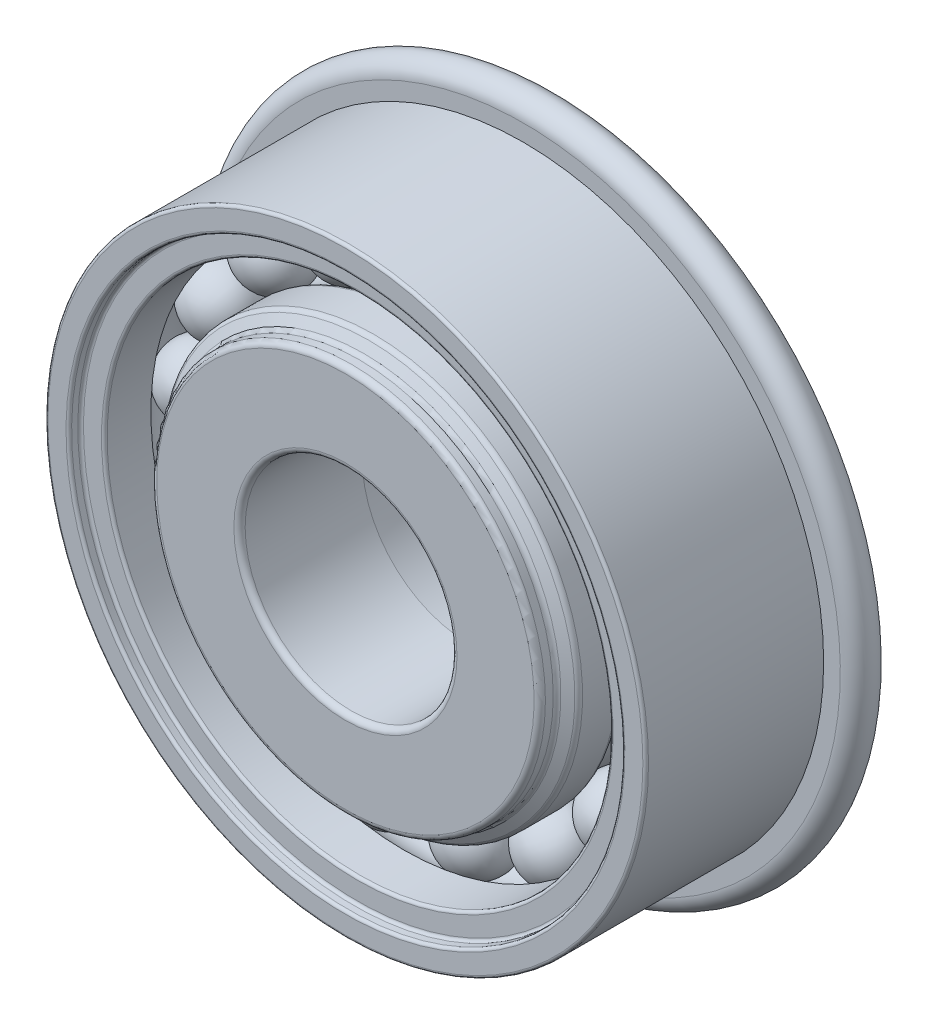
from build123d import *

# Parameters (mm, degrees)
FILLET4_R          = 0.762
CIRPATTERN3_COUNT  = 17
FILLET2_R          = 0.127
FILLET3_R          = 0.127
FILLET5_R          = 0.254
SKETCH12_R         = 12.811125
SKETCH12_R_2       = 11.37285
CUT_EXTRUDE1_DEPTH = 1.143


with BuildPart() as part:
    # Sketch2 → Revolve1 (revolve)
    with BuildSketch(Plane(origin=(0, 0, 0), x_dir=(0, 0, -1), z_dir=(1, 0, 0)), mode=Mode.PRIVATE) as revolve1_sk:
        with BuildLine():
            Line((2.4384, 13.5001), (-5.5626, 13.5001))
            Line((-5.5626, 13.5001), (-5.5626, 12.436475))
            Line((-5.5626, 12.436475), (-5.0307875, 12.436475))
            Line((-5.0307875, 12.436475), (-5.0307875, 11.37285))
            Line((-5.0307875, 11.37285), (-2.936915329, 11.37285))
            ThreePointArc((-2.936915329, 11.37285), (-1.5621, 12.1666), (-0.187284671, 11.37285))
            Line((-0.187284671, 11.37285), (3.9624, 11.37285))
            Line((3.9624, 11.37285), (3.9624, 14.2494))
            ThreePointArc((3.9624, 14.2494), (3.2004, 15.0114), (2.4384, 14.2494))
            Line((2.4384, 14.2494), (2.4384, 13.5001))
        make_face()
    revolve(revolve1_sk.sketch.rotate(Axis((0, 0, 5.5626), (0, 0, -1)), 180), axis=Axis((0, 0, 5.5626), (0, 0, -1)))

    # Fillet2
    fillet2_edges = [part.edges().sort_by_distance(p)[0] for p in [
        (0, 11.37285, 5.0307875),
        (0, 12.436475, 5.0307875),
    ]]
    fillet(fillet2_edges, radius=FILLET2_R)

    # Fillet3
    fillet3_edges = [part.edges().sort_by_distance(p)[0] for p in [
        (0, 12.436475, 5.5626),
        (0, 13.5001, 5.5626),
    ]]
    fillet(fillet3_edges, radius=FILLET3_R)

    # Sketch12 → Cut-Extrude1 (cut)
    with BuildSketch(Plane(origin=(0, 0, -3.9624), x_dir=(-1, 0, 0), z_dir=(0, 0, -1))):
        with Locations(Location((0, 0, 0), (0, 0, 90))):
            Circle(SKETCH12_R)
        with Locations(Location((0, 0, 0), (0, 0, 270))):
            Circle(SKETCH12_R_2, mode=Mode.SUBTRACT)
    extrude(amount=-CUT_EXTRUDE1_DEPTH, mode=Mode.SUBTRACT)


with BuildPart() as body_2:
    # Sketch3 → Revolve2 (revolve)
    with BuildSketch(Plane(origin=(0, 0, 0), x_dir=(0, 0, -1), z_dir=(1, 0, 0)), mode=Mode.PRIVATE) as revolve2_sk:
        with BuildLine():
            Line((-5.5626, 8.7376), (-4.811034287, 8.7376))
            Line((-4.811034287, 8.7376), (-4.435251431, 9.388475))
            Line((-4.435251431, 9.388475), (-2.612132552, 9.388475))
            ThreePointArc((-2.612132552, 9.388475), (-1.5621, 8.9916), (-0.512067448, 9.388475))
            Line((-0.512067448, 9.388475), (2.062617144, 9.388475))
            Line((2.062617144, 9.388475), (2.4384, 8.7376))
            Line((2.4384, 8.7376), (5.5626, 8.7376))
            Line((5.5626, 8.7376), (5.5626, 4.7625))
            Line((5.5626, 4.7625), (-5.5626, 4.7625))
            Line((-5.5626, 4.7625), (-5.5626, 8.7376))
        make_face()
    revolve(revolve2_sk.sketch.rotate(Axis((0, 0, 5.5626), (0, 0, -1)), 180), axis=Axis((0, 0, 5.5626), (0, 0, -1)))

    # Sketch5 → Cut-Revolve2 (revolve, cut)
    with BuildSketch(Plane(origin=(0, 0, 0), x_dir=(0, 0, -1), z_dir=(1, 0, 0)), mode=Mode.PRIVATE) as cut_revolve2_sk:
        with BuildLine():
            Line((5.5626, 5.756275), (5.5626, 4.7625))
            Line((5.5626, 4.7625), (-0.043602413, 4.7625))
            Line((-0.043602413, 4.7625), (4.892977196, 5.194394752))
            ThreePointArc((4.892977196, 5.194394752), (5.316368679, 5.369769247), (5.5626, 5.756275))
        make_face()
    revolve(cut_revolve2_sk.sketch.rotate(Axis((0, 0, 5.5626), (0, 0, -1)), 180), axis=Axis((0, 0, 5.5626), (0, 0, -1)), mode=Mode.SUBTRACT)

    # Sketch6 → Cut-Revolve3 (revolve, cut)
    with BuildSketch(Plane(origin=(0, 0, 0), x_dir=(0, 0, -1), z_dir=(1, 0, 0)), mode=Mode.PRIVATE) as cut_revolve3_sk:
        with BuildLine():
            Line((5.31725484, 5.822015037), (5.5626, 5.756275))
            Line((5.5626, 5.756275), (5.5626, 5.854885056))
            Line((5.5626, 5.854885056), (5.19458226, 5.854885056))
            ThreePointArc((5.19458226, 5.854885056), (5.0714666, 5.66163218), (4.859770858, 5.573944932))
            Line((4.859770858, 5.573944932), (3.9624, 5.495435155))
            Line((3.9624, 5.495435155), (3.9624, 5.367950036))
            Line((3.9624, 5.367950036), (4.870839638, 5.447428206))
            ThreePointArc((4.870839638, 5.447428206), (5.153100626, 5.564344535), (5.31725484, 5.822015037))
        make_face()
    revolve(cut_revolve3_sk.sketch.rotate(Axis((0, 0, 5.5626), (0, 0, -1)), 180), axis=Axis((0, 0, 5.5626), (0, 0, -1)), mode=Mode.SUBTRACT)

    # Fillet4
    # the kernel refuses this fillet: 0.762 mm, written as the material it takes off along each edge
    with BuildSketch(Plane(origin=(0, 0, -5.5626), x_dir=(0, -1, 0), z_dir=(1, 0, 0))) as fillet4_piece_1:
        with BuildLine():
            CenterArc((6.507128859, -0.762), FILLET4_R, 90, 58.866285833)
            Line((5.854885056, -0.36801774), (5.84184018, -0.360138095))
            ThreePointArc((5.84184018, -0.360138095), (5.839645056, -0.18400887), (5.839645056, 0))
            Line((5.839645056, 0), (5.854885056, 0.01524))
            Line((5.854885056, 0.01524), (6.507128859, 0.01524))
            Line((6.507128859, 0.01524), (6.507128859, 0))
        make_face()
    revolve(axis=Axis((0, 0, -5.5626), (0, 0, -1)), mode=Mode.SUBTRACT)

    # Sketch7 → Cut-Revolve4 (revolve, cut)
    with BuildSketch(Plane(origin=(0, 0, 0), x_dir=(0, 0, -1), z_dir=(1, 0, 0)), mode=Mode.PRIVATE) as cut_revolve4_sk:
        Polygon((5.5626, 7.743825), (5.5626, 8.7376), (5.231341667, 8.7376), (5.231341667, 8.406341667), (5.231341667, 8.075083333), (5.231341667, 7.743825), align=None)
    revolve(cut_revolve4_sk.sketch.rotate(Axis((0, 0, 5.5626), (0, 0, -1)), 180), axis=Axis((0, 0, 5.5626), (0, 0, -1)), mode=Mode.SUBTRACT)

    # Fillet5
    fillet5_edges = [body_2.edges().sort_by_distance(p)[0] for p in [
        (0, 4.7625, 5.5626),
        (0, 7.743825, -5.5626),
        (0, 8.7376, -5.231341667),
        (0, 8.7376, 5.5626),
        (0, 8.7376, 4.811034287),
        (0, 9.388475, 4.435251431),
        (0, 9.388475, 2.612132552),
        (0, 9.388475, 0.512067448),
        (0, 8.7376, -2.4384),
    ]]
    fillet(fillet5_edges, radius=FILLET5_R)


with BuildPart() as body_3:
    # Sketch11 → Revolve3 (revolve)
    with BuildSketch(Plane(origin=(0, 0, 0), x_dir=(0, 0, -1), z_dir=(1, 0, 0))):
        with BuildLine():
            Line((-1.5621, 12.1666), (-1.5621, 8.9916))
            ThreePointArc((-1.5621, 8.9916), (0.0254, 10.5791), (-1.5621, 12.1666))
        make_face()
    revolve(axis=Axis((0, 12.1666, 1.5621), (0, -1, 0)))


with BuildPart() as cirpattern3_1:
    # CirPattern3: pattern copy
    add(body_3.part.rotate(Axis((0, 0, 0), (0, 0, 1)), 1 * 360 / CIRPATTERN3_COUNT))


with BuildPart() as cirpattern3_2:
    # CirPattern3: pattern copy
    add(body_3.part.rotate(Axis((0, 0, 0), (0, 0, 1)), 2 * 360 / CIRPATTERN3_COUNT))


with BuildPart() as cirpattern3_3:
    # CirPattern3: pattern copy
    add(body_3.part.rotate(Axis((0, 0, 0), (0, 0, 1)), 3 * 360 / CIRPATTERN3_COUNT))


with BuildPart() as cirpattern3_4:
    # CirPattern3: pattern copy
    add(body_3.part.rotate(Axis((0, 0, 0), (0, 0, 1)), 4 * 360 / CIRPATTERN3_COUNT))


with BuildPart() as cirpattern3_5:
    # CirPattern3: pattern copy
    add(body_3.part.rotate(Axis((0, 0, 0), (0, 0, 1)), 5 * 360 / CIRPATTERN3_COUNT))


with BuildPart() as cirpattern3_6:
    # CirPattern3: pattern copy
    add(body_3.part.rotate(Axis((0, 0, 0), (0, 0, 1)), 6 * 360 / CIRPATTERN3_COUNT))


with BuildPart() as cirpattern3_7:
    # CirPattern3: pattern copy
    add(body_3.part.rotate(Axis((0, 0, 0), (0, 0, 1)), 7 * 360 / CIRPATTERN3_COUNT))


with BuildPart() as cirpattern3_8:
    # CirPattern3: pattern copy
    add(body_3.part.rotate(Axis((0, 0, 0), (0, 0, 1)), 8 * 360 / CIRPATTERN3_COUNT))


with BuildPart() as cirpattern3_9:
    # CirPattern3: pattern copy
    add(body_3.part.rotate(Axis((0, 0, 0), (0, 0, 1)), 9 * 360 / CIRPATTERN3_COUNT))


with BuildPart() as cirpattern3_10:
    # CirPattern3: pattern copy
    add(body_3.part.rotate(Axis((0, 0, 0), (0, 0, 1)), 10 * 360 / CIRPATTERN3_COUNT))


with BuildPart() as cirpattern3_11:
    # CirPattern3: pattern copy
    add(body_3.part.rotate(Axis((0, 0, 0), (0, 0, 1)), 11 * 360 / CIRPATTERN3_COUNT))


with BuildPart() as cirpattern3_12:
    # CirPattern3: pattern copy
    add(body_3.part.rotate(Axis((0, 0, 0), (0, 0, 1)), 12 * 360 / CIRPATTERN3_COUNT))


with BuildPart() as cirpattern3_13:
    # CirPattern3: pattern copy
    add(body_3.part.rotate(Axis((0, 0, 0), (0, 0, 1)), 13 * 360 / CIRPATTERN3_COUNT))


with BuildPart() as cirpattern3_14:
    # CirPattern3: pattern copy
    add(body_3.part.rotate(Axis((0, 0, 0), (0, 0, 1)), 14 * 360 / CIRPATTERN3_COUNT))


with BuildPart() as cirpattern3_15:
    # CirPattern3: pattern copy
    add(body_3.part.rotate(Axis((0, 0, 0), (0, 0, 1)), 15 * 360 / CIRPATTERN3_COUNT))


with BuildPart() as cirpattern3_16:
    # CirPattern3: pattern copy
    add(body_3.part.rotate(Axis((0, 0, 0), (0, 0, 1)), 16 * 360 / CIRPATTERN3_COUNT))


solid = Compound([part.part, body_2.part, body_3.part, cirpattern3_1.part, cirpattern3_2.part, cirpattern3_3.part, cirpattern3_4.part, cirpattern3_5.part, cirpattern3_6.part, cirpattern3_7.part, cirpattern3_8.part, cirpattern3_9.part, cirpattern3_10.part, cirpattern3_11.part, cirpattern3_12.part, cirpattern3_13.part, cirpattern3_14.part, cirpattern3_15.part, cirpattern3_16.part])
